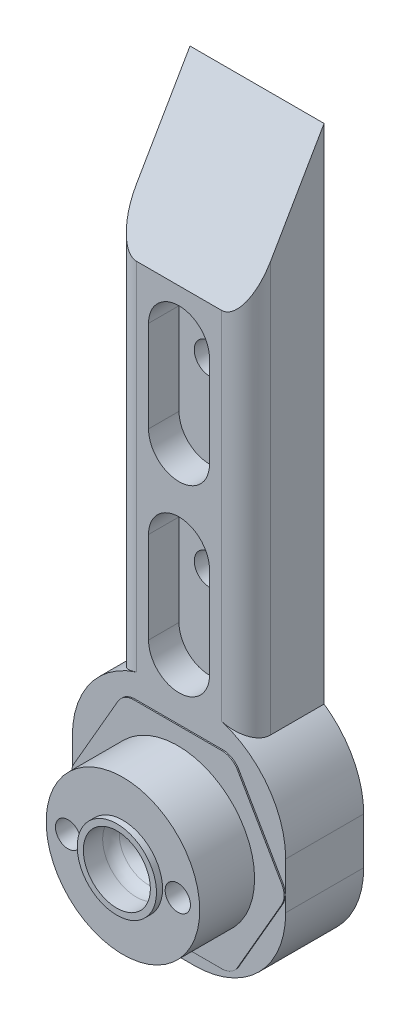
from build123d import *

# Parameters (mm, degrees)
SKETCH_1_R               = 12.6
EXTRUDE_1_DEPTH          = 9
SKETCH_2_R               = 15
EXTRUDE_2_DEPTH          = 5
SKETCH_3_R               = 5.5
CUT_EXTRUDE_1_DEPTH      = 5
SKETCH_4_R               = 2.075
CUT_EXTRUDE_2_DEPTH      = 29
SKETCH_5_R               = 3.5
CUT_EXTRUDE_3_DEPTH      = 31
FILLET_1_R               = 3
FILLET_2_R               = 5
EXTRUDE_START            = 1
SKETCH_6_R               = 6.5
SKETCH_6_R_2             = 5.5
EXTRUDE_1_2_DEPTH        = 1
EXTRUDE_START_2          = -5
SKETCH_7_R               = 15
EXTRUDE_3_DEPTH          = 5
FILLET_3_R               = 3
EXTRUDE_START_3          = 8
SKETCH_8_R               = 3.5
SKETCH_8_R_2             = 4
EXTRUDE_4_DEPTH          = 8
SKETCH_9_W               = 35
SKETCH_9_H               = 35
SKETCH_9_W_2             = 20
SKETCH_9_H_2             = 20
EXTRUDE_5_DEPTH          = 20
SKETCH_10_W              = 35
SKETCH_10_H              = 35
EXTRUDE_6_DEPTH          = 8.5
SKETCH_11_R              = 2.5
CUT_EXTRUDE_4_DEPTH      = 15
PATTERN_CIRCULAR_1_COUNT = 4
CUT_EXTRUDE_START        = 83
SKETCH_12_R              = 4
CUT_EXTRUDE_5_DEPTH      = 83
SKETCH_14_W              = 23.212780374
SKETCH_14_H              = 20
CUT_EXTRUDE_6_DEPTH      = 41
SKETCH_15_W              = 35
SKETCH_15_H              = 35
EXTRUDE_7_DEPTH          = 1.3
SKETCH_20_W              = 50.753673386
SKETCH_20_H              = 47.344844578
CUT_EXTRUDE_9_DEPTH      = 46
SKETCH_21_W              = 35
SKETCH_21_H              = 62.5
EXTRUDE_9_DEPTH          = 9.8
SKETCH_22_W              = 35
SKETCH_22_H              = 97.5
EXTRUDE_10_DEPTH         = 3
SKETCH_23_W              = 6.5
SKETCH_23_H              = 62.5
CUT_EXTRUDE_10_DEPTH     = 43
FILLET_10_R              = 15
FILLET_11_R              = 15
CUT_EXTRUDE_11_DEPTH     = 5
SKETCH_25_R              = 2.5
CUT_EXTRUDE_12_DEPTH     = 33
SKETCH_26_W              = 22
SKETCH_26_H              = 12.8
EXTRUDE_11_DEPTH         = 20
CUT_EXTRUDE_START_2      = -22
CUT_EXTRUDE_13_DEPTH     = 22
SWEEP_1_PROFILE_R        = 3
FILLET_13_R              = 3
FILLET_14_R              = 3
FILLET_15_R              = 4


# Some blends are built 0.0001 mm under size
with BuildPart() as part:
    # 草图1 → Extrude 1 (new body)
    with BuildSketch(Plane.XY):
        Circle(SKETCH_1_R)
    extrude(amount=EXTRUDE_1_DEPTH)

    # 草图2 → 凸台-拉伸2 (add)
    with BuildSketch(Plane(origin=(0, 0, 0), x_dir=(-1, 0, 0), z_dir=(0, 0, -1))):
        Circle(SKETCH_2_R)
    extrude(amount=EXTRUDE_2_DEPTH)

    # 草图3 → Cut-Extrude 1 (cut)
    with BuildSketch(Plane.XY.offset(9)):
        Circle(SKETCH_3_R)
    extrude(amount=-CUT_EXTRUDE_1_DEPTH, mode=Mode.SUBTRACT)

    # 草图4 → 切除-拉伸2 (cut)
    with BuildSketch(Plane.XY.offset(9)):
        with Locations((-9, 0)):
            Circle(SKETCH_4_R)
        with Locations((9, 0)):
            Circle(SKETCH_4_R)
    extrude(amount=-CUT_EXTRUDE_2_DEPTH, mode=Mode.SUBTRACT)

    # 草图5 → 切除-拉伸3 (cut)
    with BuildSketch(Plane.XY.offset(4)):
        Circle(SKETCH_5_R)
    extrude(amount=-CUT_EXTRUDE_3_DEPTH, mode=Mode.SUBTRACT)

    # 圆角1
    # the kernel refuses this fillet: 3 mm, written as the material it adds along each edge
    with BuildSketch(Plane(origin=(0, 0, 4), x_dir=(1, 0, 0), z_dir=(0, -1, 0))) as fillet_1_piece_1:
        with BuildLine():
            CenterArc((2.5, 2.828427125), FILLET_1_R, 289.471220634, 70.528779366)
            Line((5.5, 2.828427125), (5.56, 2.828427125))
            Line((5.56, 2.828427125), (5.56, 0))
            Line((5.56, 0), (5.5, -0.06))
            ThreePointArc((5.5, -0.06), (4.5, -0.06), (3.52, -0.056568542))
            Line((3.52, -0.056568542), (3.5, 0))
        make_face()
    revolve(axis=Axis((0, 0, 4), (0, 0, 1)))

    # 圆角2
    fillet_2_edges = [part.edges().sort_by_distance(p)[0] for p in [
        (-3.5, 0, 4),
    ]]
    fillet(fillet_2_edges, radius=FILLET_2_R)

    # 草图6 → Extrude 1 2 (add)
    with BuildSketch(Plane.XY.offset(9).offset(EXTRUDE_START)):
        Circle(SKETCH_6_R)
        Circle(SKETCH_6_R_2, mode=Mode.SUBTRACT)
    extrude(amount=-EXTRUDE_1_2_DEPTH)

    # 草图7 → 凸台-拉伸3 (add)
    with BuildSketch(Plane(origin=(0, 0, -5), x_dir=(-1, 0, 0), z_dir=(0, 0, -1)).offset(EXTRUDE_START_2)):
        Polygon((-8.948929172, 15.5), (-17.897858345, 0), (-8.948929172, -15.5), (8.948929172, -15.5), (17.897858345, 0), (8.948929172, 15.5), align=None)
        Circle(SKETCH_7_R, mode=Mode.SUBTRACT)
    extrude(amount=EXTRUDE_3_DEPTH)

    # 圆角3
    fillet_3_edges = [part.edges().sort_by_distance(p)[0] for p in [
        (17.897858345, 0, -2.5),
        (8.948929172, -15.5, -2.5),
        (-8.948929172, -15.5, -2.5),
        (-17.897858345, 0, -2.5),
        (-8.948929172, 15.5, -2.5),
        (8.948929172, 15.5, -2.5),
    ]]
    fillet(fillet_3_edges, radius=FILLET_3_R)

    # 草图8 → 凸台-拉伸4 (add)
    with BuildSketch(Plane(origin=(0, 0, -5), x_dir=(-1, 0, 0), z_dir=(0, 0, -1)).offset(EXTRUDE_START_3)):
        with BuildLine():
            Line((-9.814954576, 14), (-17.031832941, 1.5))
            ThreePointArc((-17.031832941, 1.5), (-17.43375673, 0), (-17.031832941, -1.5))
            Line((-17.031832941, -1.5), (-9.814954576, -14))
            ThreePointArc((-9.814954576, -14), (-8.716878365, -15.098076211), (-7.216878365, -15.5))
            Line((-7.216878365, -15.5), (7.216878365, -15.5))
            ThreePointArc((7.216878365, -15.5), (8.716878365, -15.098076211), (9.814954576, -14))
            Line((9.814954576, -14), (17.031832941, -1.5))
            ThreePointArc((17.031832941, -1.5), (17.43375673, 0), (17.031832941, 1.5))
            Line((17.031832941, 1.5), (9.814954576, 14))
            ThreePointArc((9.814954576, 14), (8.716878365, 15.098076211), (7.216878365, 15.5))
            Line((7.216878365, 15.5), (-7.216878365, 15.5))
            ThreePointArc((-7.216878365, 15.5), (-8.716878365, 15.098076211), (-9.814954576, 14))
        make_face()
        Circle(SKETCH_8_R, mode=Mode.SUBTRACT)
        with Locations((-9, 0)):
            Circle(SKETCH_8_R_2, mode=Mode.SUBTRACT)
        with Locations((9, 0)):
            Circle(SKETCH_8_R_2, mode=Mode.SUBTRACT)
    extrude(amount=-EXTRUDE_4_DEPTH)

    # 草图9 → 凸台-拉伸5 (add)
    with BuildSketch(Plane(origin=(0, 0, -13), x_dir=(-1, 0, 0), z_dir=(0, 0, -1))):
        Rectangle(SKETCH_9_W, SKETCH_9_H)
        Rectangle(SKETCH_9_W_2, SKETCH_9_H_2, mode=Mode.SUBTRACT)
    extrude(amount=EXTRUDE_5_DEPTH)

    # 草图10 → 凸台-拉伸6 (add)
    with BuildSketch(Plane.XY.offset(-13)):
        Rectangle(SKETCH_10_W, SKETCH_10_H)
        with BuildLine():
            Line((7.216878365, 15.5), (-7.216878365, 15.5))
            ThreePointArc((-7.216878365, 15.5), (-8.716878365, 15.098076211), (-9.814954576, 14))
            Line((-9.814954576, 14), (-17.031832941, 1.5))
            ThreePointArc((-17.031832941, 1.5), (-17.43375673, 0), (-17.031832941, -1.5))
            Line((-17.031832941, -1.5), (-9.814954576, -14))
            ThreePointArc((-9.814954576, -14), (-8.716878365, -15.098076211), (-7.216878365, -15.5))
            Line((-7.216878365, -15.5), (7.216878365, -15.5))
            ThreePointArc((7.216878365, -15.5), (8.716878365, -15.098076211), (9.814954576, -14))
            Line((9.814954576, -14), (17.031832941, -1.5))
            ThreePointArc((17.031832941, -1.5), (17.43375673, 0), (17.031832941, 1.5))
            Line((17.031832941, 1.5), (9.814954576, 14))
            ThreePointArc((9.814954576, 14), (8.716878365, 15.098076211), (7.216878365, 15.5))
        make_face(mode=Mode.SUBTRACT)
    extrude(amount=EXTRUDE_6_DEPTH)

    # 草图11 → 切除-拉伸4 (cut)
    with BuildSketch(Plane.ZY.offset(17.5)):
        with Locations(Location((-23, 0, 0), (0, 0, 270))):
            Circle(SKETCH_11_R)
    cut_extrude_4 = extrude(amount=-CUT_EXTRUDE_4_DEPTH, mode=Mode.SUBTRACT)

    # 阵列(圆周)1: 切除-拉伸4 ×4 about axis
    pattern_circular_1_axis = Axis((0, 0, -27), (0, 0, 1))
    for i in range(1, PATTERN_CIRCULAR_1_COUNT):
        add(cut_extrude_4.rotate(pattern_circular_1_axis, i * 360 / PATTERN_CIRCULAR_1_COUNT), mode=Mode.SUBTRACT)

    # 草图12 → 切除-拉伸5 (cut)
    with BuildSketch(Plane(origin=(0, 0, -5), x_dir=(-1, 0, 0), z_dir=(0, 0, -1)).offset(CUT_EXTRUDE_START)):
        with Locations(Location((9, 0, 0), (0, 0, 75.522487814))):
            Circle(SKETCH_12_R)
        with Locations(Location((-9, 0, 0), (0, 0, 255.522487814))):
            Circle(SKETCH_12_R)
    extrude(amount=-CUT_EXTRUDE_5_DEPTH, mode=Mode.SUBTRACT)

    # 草图14 → 切除-拉伸6 (cut)
    with BuildSketch(Plane(origin=(0, 0, -13), x_dir=(-1, 0, 0), z_dir=(0, 0, -1))):
        with Locations((21.606390187, 0)):
            Rectangle(SKETCH_14_W, SKETCH_14_H)
    extrude(amount=CUT_EXTRUDE_6_DEPTH, mode=Mode.SUBTRACT)

    # 草图15 → 凸台-拉伸7 (add)
    with BuildSketch(Plane.XY.offset(-4.5)):
        Rectangle(SKETCH_15_W, SKETCH_15_H)
        with BuildLine():
            Line((9.814954576, -14), (17.031832941, -1.5))
            ThreePointArc((17.031832941, -1.5), (17.43375673, 0), (17.031832941, 1.5))
            Line((17.031832941, 1.5), (9.814954576, 14))
            ThreePointArc((9.814954576, 14), (8.716878365, 15.098076211), (7.216878365, 15.5))
            Line((7.216878365, 15.5), (-7.216878365, 15.5))
            ThreePointArc((-7.216878365, 15.5), (-8.716878365, 15.098076211), (-9.814954576, 14))
            Line((-9.814954576, 14), (-17.031832941, 1.5))
            ThreePointArc((-17.031832941, 1.5), (-17.43375673, 0), (-17.031832941, -1.5))
            Line((-17.031832941, -1.5), (-9.814954576, -14))
            ThreePointArc((-9.814954576, -14), (-8.716878365, -15.098076211), (-7.216878365, -15.5))
            Line((-7.216878365, -15.5), (7.216878365, -15.5))
            ThreePointArc((7.216878365, -15.5), (8.716878365, -15.098076211), (9.814954576, -14))
        make_face(mode=Mode.SUBTRACT)
    extrude(amount=EXTRUDE_7_DEPTH)

    # 草图20 → 切除-拉伸9 (cut)
    with BuildSketch(Plane(origin=(0, 0, -13), x_dir=(-1, 0, 0), z_dir=(0, 0, -1))):
        Rectangle(SKETCH_20_W, SKETCH_20_H)
    extrude(amount=CUT_EXTRUDE_9_DEPTH, mode=Mode.SUBTRACT)

    # 草图21 → 凸台-拉伸9 (add)
    with BuildSketch(Plane(origin=(0, 0, -13), x_dir=(-1, 0, 0), z_dir=(0, 0, -1))):
        with Locations((0, 48.75)):
            Rectangle(SKETCH_21_W, SKETCH_21_H)
    extrude(amount=-EXTRUDE_9_DEPTH)

    # 草图22 → 凸台-拉伸10 (add)
    with BuildSketch(Plane.XY.offset(-3.2)):
        with Locations((0, 31.25)):
            Rectangle(SKETCH_22_W, SKETCH_22_H)
        with BuildLine():
            Line((9.814954576, -14), (17.031832941, -1.5))
            ThreePointArc((17.031832941, -1.5), (17.43375673, 0), (17.031832941, 1.5))
            Line((17.031832941, 1.5), (9.814954576, 14))
            ThreePointArc((9.814954576, 14), (8.716878365, 15.098076211), (7.216878365, 15.5))
            Line((7.216878365, 15.5), (-7.216878365, 15.5))
            ThreePointArc((-7.216878365, 15.5), (-8.716878365, 15.098076211), (-9.814954576, 14))
            Line((-9.814954576, 14), (-17.031832941, 1.5))
            ThreePointArc((-17.031832941, 1.5), (-17.43375673, 0), (-17.031832941, -1.5))
            Line((-17.031832941, -1.5), (-9.814954576, -14))
            ThreePointArc((-9.814954576, -14), (-8.716878365, -15.098076211), (-7.216878365, -15.5))
            Line((-7.216878365, -15.5), (7.216878365, -15.5))
            ThreePointArc((7.216878365, -15.5), (8.716878365, -15.098076211), (9.814954576, -14))
        make_face(mode=Mode.SUBTRACT)
    extrude(amount=EXTRUDE_10_DEPTH)

    # 草图23 → 切除-拉伸10 (cut)
    with BuildSketch(Plane(origin=(0, 0, -13), x_dir=(-1, 0, 0), z_dir=(0, 0, -1))):
        with Locations((-14.25, 48.75)):
            Rectangle(SKETCH_23_W, SKETCH_23_H)
        with Locations((14.25, 48.75)):
            Rectangle(SKETCH_23_W, SKETCH_23_H)
    extrude(amount=-CUT_EXTRUDE_10_DEPTH, mode=Mode.SUBTRACT)

    # 圆角10
    fillet_10_edges = [part.edges().sort_by_distance(p)[0] for p in [
        (17.5, -17.5, -6.6),
        (-17.5, -17.5, -6.6),
    ]]
    fillet(fillet_10_edges, radius=FILLET_10_R)

    # 圆角11
    # the kernel refuses this fillet: 15 mm, written as the material it takes off along each edge
    with BuildSketch(Plane(origin=(17.5, 17.5, -43.898017736), x_dir=(0, -1, 0), z_dir=(0, 0, 1))) as fillet_11_piece_1:
        with BuildLine():
            CenterArc((12.359207094, -15), FILLET_11_R, 90, 55.481892159)
            Line((0, -6.5), (-0.247184142, -6.33))
            ThreePointArc((-0.247184142, -6.33), (-0.3, -3.25), (-0.3, 0))
            Line((-0.3, 0), (0, 0.3))
            Line((0, 0.3), (12.359207094, 0.3))
            Line((12.359207094, 0.3), (12.359207094, 0))
        make_face()
    extrude(amount=74.596035472, mode=Mode.SUBTRACT)
    with BuildSketch(Plane(origin=(-17.5, 17.5, -43.898017736), x_dir=(0, -1, 0), z_dir=(0, 0, 1))) as fillet_11_piece_2:
        with BuildLine():
            CenterArc((12.359207094, 15), FILLET_11_R, 214.518107841, 55.481892159)
            Line((0, 6.5), (-0.247184142, 6.33))
            ThreePointArc((-0.247184142, 6.33), (-0.3, 3.25), (-0.3, 0))
            Line((-0.3, 0), (0, -0.3))
            Line((0, -0.3), (12.359207094, -0.3))
            Line((12.359207094, -0.3), (12.359207094, 0))
        make_face()
    extrude(amount=74.596035472, mode=Mode.SUBTRACT)

    # 草图24 → 切除-拉伸11 (cut)
    with BuildSketch(Plane.XY.offset(-0.2)):
        with BuildLine():
            Line((5, 70), (5, 55))
            ThreePointArc((5, 55), (0, 50), (-5, 55))
            Line((-5, 55), (-5, 70))
            ThreePointArc((-5, 70), (0, 75), (5, 70))
        make_face()
        with BuildLine():
            Line((5, 40), (5, 25))
            ThreePointArc((5, 25), (0, 20), (-5, 25))
            Line((-5, 25), (-5, 40))
            ThreePointArc((-5, 40), (0, 45), (5, 40))
        make_face()
    extrude(amount=-CUT_EXTRUDE_11_DEPTH, mode=Mode.SUBTRACT)

    # 草图25 → 切除-拉伸12 (cut)
    with BuildSketch(Plane.XY.offset(-5.2)):
        with Locations((0, 65)):
            Circle(SKETCH_25_R)
        with Locations((0, 35)):
            Circle(SKETCH_25_R)
    extrude(amount=-CUT_EXTRUDE_12_DEPTH, mode=Mode.SUBTRACT)

    # 草图26 → 凸台-拉伸11 (add)
    with BuildSketch(Plane(origin=(0, 80, 0), x_dir=(1, 0, 0), z_dir=(0, 1, 0))):
        with Locations((0, 6.6)):
            Rectangle(SKETCH_26_W, SKETCH_26_H)
    extrude(amount=EXTRUDE_11_DEPTH)

    # 草图27 → 切除-拉伸13 (cut)
    with BuildSketch(Plane.ZY.offset(11).offset(CUT_EXTRUDE_START_2)):
        Polygon((-13, 100), (-0.2, 77.829749663), (-0.2, 100), align=None)
    extrude(amount=CUT_EXTRUDE_13_DEPTH, mode=Mode.SUBTRACT)

    # 切除-扫描1: sweep along a path in 草图28
    with BuildLine(Plane(origin=(0, 0, -13), x_dir=(-1, 0, 0), z_dir=(0, 0, -1))) as sweep_1_path:
        Line((7, 90), (7, 10))
    # 切除-扫描1 profile (on start of the path) → 切除-扫描1 (sweep, cut)
    with BuildSketch(Plane(origin=(-7, 90, -13), x_dir=(-1, 0, 0), z_dir=(0, -1, 0))):
        Circle(SWEEP_1_PROFILE_R)
    sweep(path=sweep_1_path.line, mode=Mode.SUBTRACT)

    # 圆角13
    fillet_13_edges = [part.edges().sort_by_distance(p)[0] for p in [
        (-7, 10, -10),
    ]]
    fillet(fillet_13_edges, radius=FILLET_13_R - 0.0001)  # a hair under: the kernel refuses the full size

    # 圆角14
    fillet_14_edges = [part.edges().sort_by_distance(p)[0] for p in [
        (-7, 90, -10),
    ]]
    fillet(fillet_14_edges, radius=FILLET_14_R - 0.0001)  # a hair under: the kernel refuses the full size

    # 圆角15
    fillet_15_edges = [part.edges().sort_by_distance(p)[0] for p in [
        (11, 47.664874832, -0.2),
        (-11, 47.664874832, -0.2),
    ]]
    fillet(fillet_15_edges, radius=FILLET_15_R)


solid = part.part
